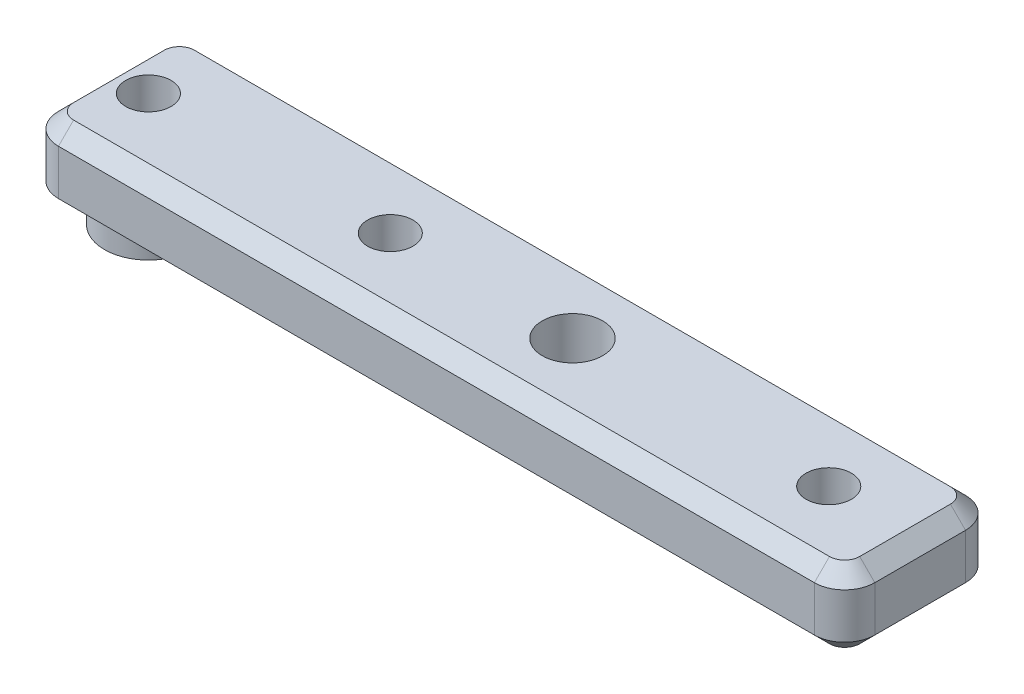
from build123d import *

# Parameters (mm, degrees)
SKETCH1_W           = 54
SKETCH1_H           = 10
BOSS_EXTRUDE1_DEPTH = 5
SKETCH3_R           = 1.5
SKETCH3_R_2         = 2
CUT_EXTRUDE1_DEPTH  = 7
FILLET1_R           = 2
SKETCH4_R           = 2.9
SKETCH4_R_2         = 1.5
BOSS_EXTRUDE2_DEPTH = 2.5
CHAMFER1_SIZE       = 1


with BuildPart() as part:
    # Sketch1 → Boss-Extrude1 (new body)
    with BuildSketch(Plane(origin=(0, 0, 0), x_dir=(1, 0, 0), z_dir=(0, 1, 0))):
        Rectangle(SKETCH1_W, SKETCH1_H)
    extrude(amount=BOSS_EXTRUDE1_DEPTH)

    # Sketch3 → Cut-Extrude1 (cut)
    with BuildSketch(Plane(origin=(0, 5, 0), x_dir=(1, 0, 0), z_dir=(0, 1, 0))):
        with Locations(Location((-24.05, 0, 0), (0, 0, 270))):
            Circle(SKETCH3_R)
        with Locations(Location((4, 0, 0), (0, 0, 270))):
            Circle(SKETCH3_R_2)
        with Locations(Location((-8.05, 0, 0), (0, 0, 270))):
            Circle(SKETCH3_R)
        with Locations(Location((20.95, 0, 0), (0, 0, 270))):
            Circle(SKETCH3_R)
    extrude(amount=-CUT_EXTRUDE1_DEPTH, mode=Mode.SUBTRACT)

    # Fillet1
    fillet1_edges = [part.edges().sort_by_distance(p)[0] for p in [
        (27, 2.5, 5),
        (-27, 2.5, 5),
        (-27, 2.5, -5),
        (27, 2.5, -5),
    ]]
    fillet(fillet1_edges, radius=FILLET1_R)

    # Sketch4 → Boss-Extrude2 (add)
    with BuildSketch(Plane.XZ):
        with Locations(Location((-24.05, 0, 0), (0, 0, 270))):
            Circle(SKETCH4_R)
        with Locations(Location((-24.05, 0, 0), (0, 0, 90))):
            Circle(SKETCH4_R_2, mode=Mode.SUBTRACT)
    extrude(amount=BOSS_EXTRUDE2_DEPTH)

    # Chamfer1
    # the kernel refuses this chamfer: 1 mm, written as the material it takes off along each edge
    with BuildSketch(Plane(origin=(-25, 0, -5), x_dir=(0, 0.9996219169112968, -0.027495876610586494), z_dir=(1, 0, 0)), Plane(origin=(25, 5, 5), x_dir=(0, 0.027495876610586487, -0.9996219169112968), z_dir=(-1, 0, 0))) as chamfer1_piece_1:
        Polygon((CHAMFER1_SIZE * 0.999621916911, CHAMFER1_SIZE * 0.0274958766106), (-CHAMFER1_SIZE * 0.0274958766106, CHAMFER1_SIZE * 0.999621916911), (0, 0), align=None)
    extrude(amount=50, mode=Mode.SUBTRACT)
    with BuildSketch(Plane(origin=(-25, 5, -5), x_dir=(0, -0.9996219169112968, -0.027495876610586487), z_dir=(1, 0, 0)), Plane(origin=(25, 0, 5), x_dir=(0, -0.027495876610586365, -0.9996219169112968), z_dir=(-1, 0, 0))) as chamfer1_piece_2:
        Polygon((CHAMFER1_SIZE * 0.999621916911, -CHAMFER1_SIZE * 0.0274958766106), (-CHAMFER1_SIZE * 0.0274958766106, -CHAMFER1_SIZE * 0.999621916911), (0, 0), align=None)
    extrude(amount=50, mode=Mode.SUBTRACT)
    with BuildSketch(Plane(origin=(27, 0, -3), x_dir=(-0.9996219169112968, -0.02749587661058639, 0), z_dir=(0, 0, 1))) as chamfer1_piece_3:
        Polygon((CHAMFER1_SIZE * 0.999621916911, -CHAMFER1_SIZE * 0.0274958766106), (-CHAMFER1_SIZE * 0.0274958766106, -CHAMFER1_SIZE * 0.999621916911), (0, 0), align=None)
    extrude(amount=6, mode=Mode.SUBTRACT)
    with BuildSketch(Plane(origin=(-27, 0, 3), x_dir=(0.9996219169112968, -0.02749587661058639, 0), z_dir=(0, 0, -1))) as chamfer1_piece_4_section:
        Polygon((CHAMFER1_SIZE * 0.999621916911, -CHAMFER1_SIZE * 0.0274958766106), (-CHAMFER1_SIZE * 0.0274958766106, -CHAMFER1_SIZE * 0.999621916911), (0, 0), align=None)
    chamfer1_piece_4 = extrude(amount=6, mode=Mode.PRIVATE)
    chamfer1_piece_4 = chamfer1_piece_4 - Plane(origin=(-24.05, 0.490897833, 0), x_dir=(0, 0, -1), z_dir=(0, 1, 0)) * Cylinder(2.9, 16, mode=Mode.PRIVATE)
    add(chamfer1_piece_4, mode=Mode.SUBTRACT)
    with BuildSketch(Plane(origin=(-25, 0, 3), x_dir=(-1, 0, 0), z_dir=(0, 0, -1))) as chamfer1_piece_5:
        Polygon((2 - CHAMFER1_SIZE, 0), (2, CHAMFER1_SIZE), (2, 0), align=None)
    revolve(axis=Axis((-25, 0, 3), (0, 1, 0)), revolution_arc=90, mode=Mode.SUBTRACT)
    with BuildSketch(Plane(origin=(25, 0, 3), x_dir=(1, 0, 0), z_dir=(0, 0, -1))) as chamfer1_piece_6:
        Polygon((2 - CHAMFER1_SIZE, 0), (2, -CHAMFER1_SIZE), (2, 0), align=None)
    revolve(axis=Axis((25, 0, 3), (0, -1, 0)), revolution_arc=90, mode=Mode.SUBTRACT)
    with BuildSketch(Plane(origin=(-25, 0, -3), x_dir=(0, 0, -1), z_dir=(1, 0, 0))) as chamfer1_piece_7:
        Polygon((2 - CHAMFER1_SIZE, 0), (2, CHAMFER1_SIZE), (2, 0), align=None)
    revolve(axis=Axis((-25, 0, -3), (0, 1, 0)), revolution_arc=90, mode=Mode.SUBTRACT)
    with BuildSketch(Plane(origin=(25, 0, -3), x_dir=(0, 0, -1), z_dir=(-1, 0, 0))) as chamfer1_piece_8:
        Polygon((2 - CHAMFER1_SIZE, 0), (2, -CHAMFER1_SIZE), (2, 0), align=None)
    revolve(axis=Axis((25, 0, -3), (0, -1, 0)), revolution_arc=90, mode=Mode.SUBTRACT)
    with BuildSketch(Plane(origin=(27, 5, -3), x_dir=(-0.9996219169112968, 0.02749587661058651, 0), z_dir=(0, 0, 1)), Plane(origin=(-27, 5, 3), x_dir=(0.9996219169112968, 0.02749587661058651, 0), z_dir=(0, 0, -1))) as chamfer1_piece_9:
        Polygon((CHAMFER1_SIZE * 0.999621916911, CHAMFER1_SIZE * 0.0274958766106), (-CHAMFER1_SIZE * 0.0274958766106, CHAMFER1_SIZE * 0.999621916911), (0, 0), align=None)
    extrude(amount=6, mode=Mode.SUBTRACT)
    with BuildSketch(Plane(origin=(-25, 5, 3), x_dir=(-1, 0, 0), z_dir=(0, 0, -1))) as chamfer1_piece_10:
        Polygon((2 - CHAMFER1_SIZE, 0), (2, -CHAMFER1_SIZE), (2, 0), align=None)
    revolve(axis=Axis((-25, 5, 3), (0, 1, 0)), revolution_arc=90, mode=Mode.SUBTRACT)
    with BuildSketch(Plane(origin=(25, 5, 3), x_dir=(1, 0, 0), z_dir=(0, 0, -1))) as chamfer1_piece_11:
        Polygon((2 - CHAMFER1_SIZE, 0), (2, CHAMFER1_SIZE), (2, 0), align=None)
    revolve(axis=Axis((25, 5, 3), (0, -1, 0)), revolution_arc=90, mode=Mode.SUBTRACT)
    with BuildSketch(Plane(origin=(-25, 5, -3), x_dir=(0, 0, -1), z_dir=(1, 0, 0))) as chamfer1_piece_12:
        Polygon((2, -CHAMFER1_SIZE), (2 - CHAMFER1_SIZE, 0), (2, 0), align=None)
    revolve(axis=Axis((-25, 5, -3), (0, 1, 0)), revolution_arc=90, mode=Mode.SUBTRACT)
    with BuildSketch(Plane(origin=(25, 5, -3), x_dir=(0, 0, -1), z_dir=(-1, 0, 0))) as chamfer1_piece_13:
        Polygon((2, CHAMFER1_SIZE), (2 - CHAMFER1_SIZE, 0), (2, 0), align=None)
    revolve(axis=Axis((25, 5, -3), (0, -1, 0)), revolution_arc=90, mode=Mode.SUBTRACT)


solid = part.part
